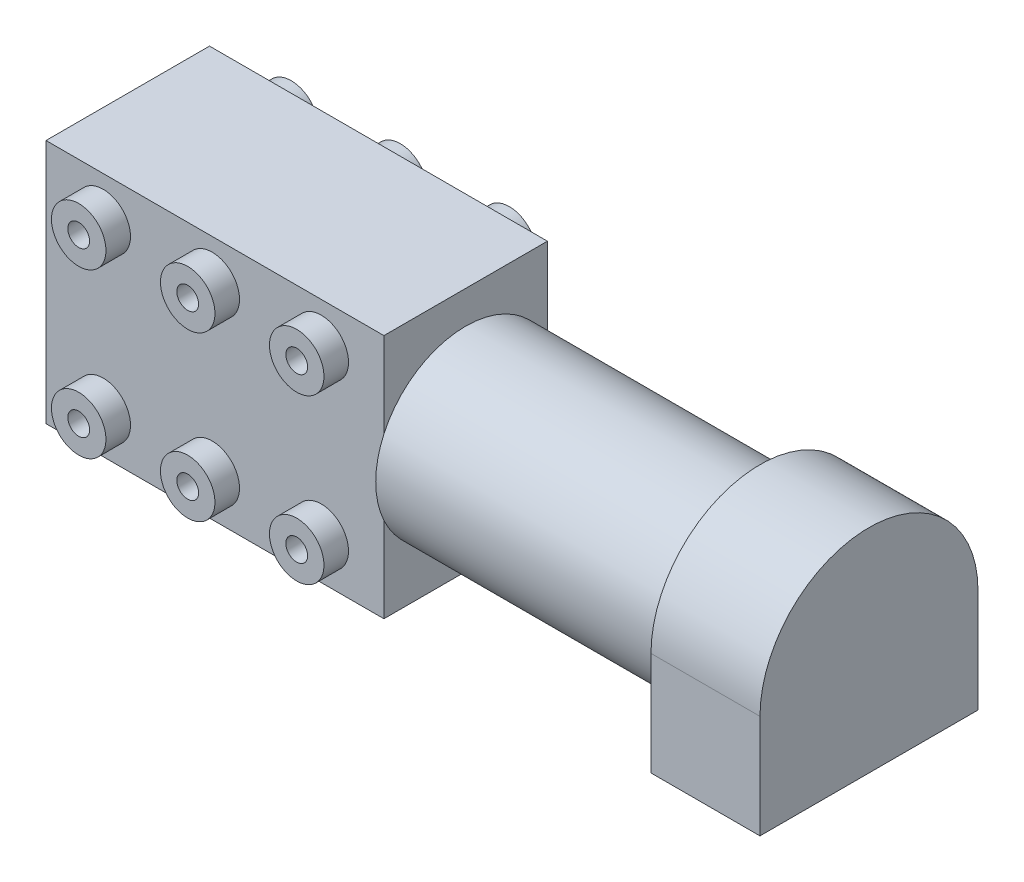
from build123d import *

# Parameters (mm, degrees)
SKETCH_1_W          = 62
SKETCH_1_H          = 45
EXTRUDE_1_DEPTH     = 30
SKETCH_2_R          = 16.5
EXTRUDE_2_DEPTH     = 52
SKETCH_4_W          = 40
SKETCH_4_H          = 39
EXTRUDE_4_DEPTH     = 20
CUT_EXTRUDE_1_REACH = 144.518
SKETCH_8_R          = 5
SKETCH_8_R_2        = 2
EXTRUDE_6_DEPTH     = 4.5
SKETCH_8_3_R        = 6
EXTRUDE_7_DEPTH     = 4.5
SKETCH_9_R          = 4
CUT_EXTRUDE_2_DEPTH = 10


with BuildPart() as part:
    # 스케치1 → 보스-돌출1 (new body)
    with BuildSketch(Plane.XY.offset(10)):
        Rectangle(SKETCH_1_W, SKETCH_1_H)
    extrude(amount=EXTRUDE_1_DEPTH)

    # 스케치2 → 보스-돌출2 (add)
    with BuildSketch(Plane(origin=(31, 0, 0), x_dir=(0, 0, -1), z_dir=(1, 0, 0))):
        with Locations((-25, 0)):
            Circle(SKETCH_2_R)
    extrude(amount=EXTRUDE_2_DEPTH)

    # 스케치4 → 보스-돌출4 (add)
    with BuildSketch(Plane(origin=(83, 0, 0), x_dir=(0, 0, -1), z_dir=(1, 0, 0))):
        with Locations((-23, 0)):
            Rectangle(SKETCH_4_W, SKETCH_4_H)
    extrude(amount=EXTRUDE_4_DEPTH)

    # 스케치6 → 컷-돌출1 (cut, up to next)
    with BuildSketch(Plane(origin=(103, 0, 0), x_dir=(0, 0, -1), z_dir=(1, 0, 0)), mode=Mode.PRIVATE) as cut_extrude_1_sk1:
        with BuildLine():
            Line((-3, 19.5), (-23.000000031, 19.5))
            ThreePointArc((-23.000000031, 19.5), (-8.857864387, 13.642135635), (-3, -0.5))
            Line((-3, -0.5), (-3, 19.5))
        make_face()
    cut_extrude_1_tool1 = extrude(cut_extrude_1_sk1.sketch, amount=-CUT_EXTRUDE_1_REACH, mode=Mode.PRIVATE) & part.part
    # 스케치6 → 컷-돌출1 (cut, up to next)
    with BuildSketch(Plane(origin=(103, 0, 0), x_dir=(0, 0, -1), z_dir=(1, 0, 0)), mode=Mode.PRIVATE) as cut_extrude_1_sk2:
        with BuildLine():
            Line((-43, 19.5), (-43, -0.5))
            ThreePointArc((-43, -0.5), (-37.142135635, 13.642135613), (-23.000000031, 19.5))
            Line((-23.000000031, 19.5), (-43, 19.5))
        make_face()
    cut_extrude_1_tool2 = extrude(cut_extrude_1_sk2.sketch, amount=-CUT_EXTRUDE_1_REACH, mode=Mode.PRIVATE) & part.part
    add(cut_extrude_1_tool1.solids().sort_by_distance((103, 15.032641, 7.467359))[0], mode=Mode.SUBTRACT)
    add(cut_extrude_1_tool2.solids().sort_by_distance((103, 15.032641, 38.532641))[0], mode=Mode.SUBTRACT)

    # 스케치8 → 보스-돌출6 (add)
    # profile 1 of 6: a face of its own
    with BuildSketch(Plane(origin=(0, 0, 10), x_dir=(-1, 0, 0), z_dir=(0, 0, -1))):
        with Locations((20.5, -15)):
            Circle(SKETCH_8_R)
        with Locations((20.5, -15)):
            Circle(SKETCH_8_R_2, mode=Mode.SUBTRACT)
    # profile 2 of 6: a face of its own
    with BuildSketch(Plane(origin=(0, 0, 10), x_dir=(-1, 0, 0), z_dir=(0, 0, -1))):
        with Locations((20.5, 15)):
            Circle(SKETCH_8_R)
        with Locations((20.5, 15)):
            Circle(SKETCH_8_R_2, mode=Mode.SUBTRACT)
    # profile 3 of 6: a face of its own
    with BuildSketch(Plane(origin=(0, 0, 10), x_dir=(-1, 0, 0), z_dir=(0, 0, -1))):
        with Locations((0.5, 15)):
            Circle(SKETCH_8_R)
        with Locations((0.5, 15)):
            Circle(SKETCH_8_R_2, mode=Mode.SUBTRACT)
    # profile 4 of 6: a face of its own
    with BuildSketch(Plane(origin=(0, 0, 10), x_dir=(-1, 0, 0), z_dir=(0, 0, -1))):
        with Locations((0.5, -15)):
            Circle(SKETCH_8_R)
        with Locations((0.5, -15)):
            Circle(SKETCH_8_R_2, mode=Mode.SUBTRACT)
    # profile 5 of 6: a face of its own
    with BuildSketch(Plane(origin=(0, 0, 10), x_dir=(-1, 0, 0), z_dir=(0, 0, -1))):
        with Locations((-19.5, 15)):
            Circle(SKETCH_8_R)
        with Locations((-19.5, 15)):
            Circle(SKETCH_8_R_2, mode=Mode.SUBTRACT)
    # profile 6 of 6: a face of its own
    with BuildSketch(Plane(origin=(0, 0, 10), x_dir=(-1, 0, 0), z_dir=(0, 0, -1))):
        with Locations((-19.5, -15)):
            Circle(SKETCH_8_R)
        with Locations((-19.5, -15)):
            Circle(SKETCH_8_R_2, mode=Mode.SUBTRACT)
    extrude_6 = extrude(amount=EXTRUDE_6_DEPTH)

    # 대칭 복사1: 보스-돌출6 across plane
    add(extrude_6.mirror(Plane(origin=(0, 0, 25), x_dir=(1, 0, 0), z_dir=(0, 0, -1))))

    # 스케치8<3> → 보스-돌출7 (add)
    with BuildSketch(Plane(origin=(0, 0, 10), x_dir=(-1, 0, 0), z_dir=(0, 0, -1))):
        with Locations((12.5, 0)):
            Circle(SKETCH_8_3_R)
    extrude(amount=EXTRUDE_7_DEPTH)

    # 스케치9 → 컷-돌출2 (cut)
    with BuildSketch(Plane(origin=(0, 0, 5.5), x_dir=(-1, 0, 0), z_dir=(0, 0, -1))):
        with Locations((12.5, 0)):
            Circle(SKETCH_9_R)
    extrude(amount=-CUT_EXTRUDE_2_DEPTH, mode=Mode.SUBTRACT)


solid = part.part
